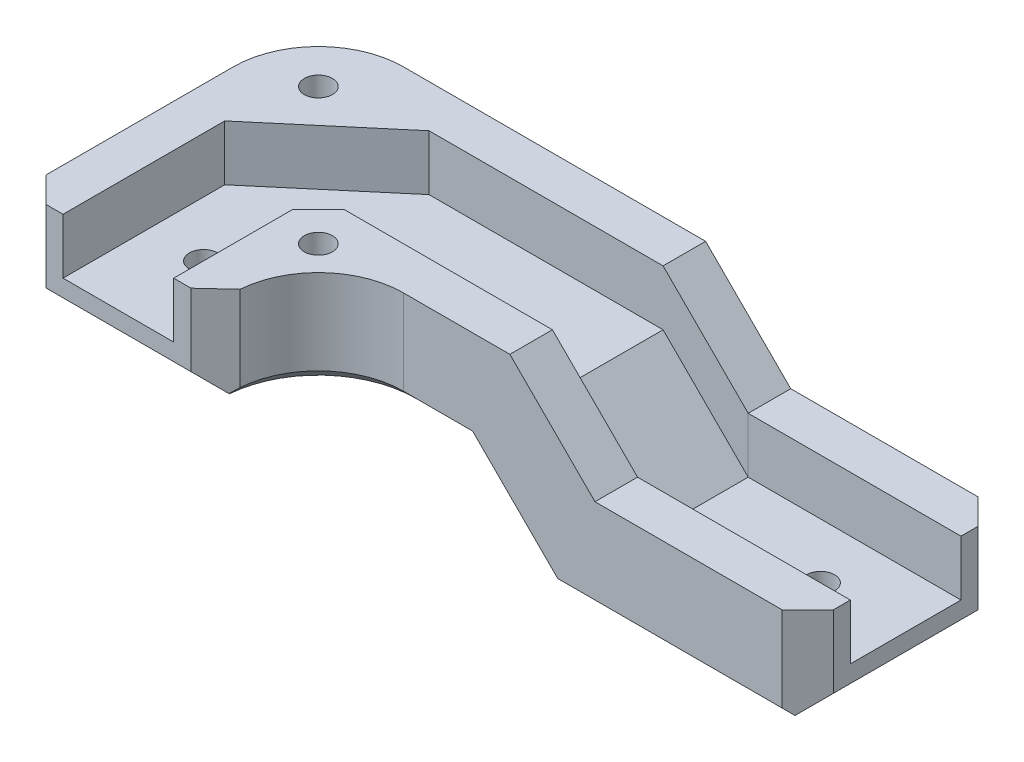
from build123d import *

# Parameters (mm, degrees)
SKETCH_1_W               = 23
SKETCH_1_H               = 23
SKETCH_1_W_2             = 13
SKETCH_1_H_2             = 13
EXTRUDE_1_DEPTH          = 35
SKETCH_2_R               = 1.65
CUT_EXTRUDE_1_DEPTH      = 34
SKETCH_4_W               = 23
SKETCH_4_H               = 23
SKETCH_4_R               = 3
EXTRUDE_2_DEPTH          = 3.5
SKETCH_5_W               = 23
SKETCH_5_H               = 23
SKETCH_5_W_2             = 13
SKETCH_5_H_2             = 13
EXTRUDE_1_2_DEPTH        = 54
SKETCH_6_R               = 1.65
CUT_EXTRUDE_2_DEPTH      = 39
SKETCH_7_W               = 13
SKETCH_7_H               = 13
CUT_EXTRUDE_3_DEPTH      = 13
CHAMFER_1_SIZE           = 3
SKETCH_8_W               = 80.5
SKETCH_8_H               = 35
CUT_EXTRUDE_4_DEPTH      = 11.5
EXTRUDE_3_DEPTH          = 6.5
FILLET_1_R               = 10
FILLET_2_R               = 10
SKETCH_10_R              = 1.65
CUT_EXTRUDE_5_DEPTH      = 28.5
CHAMFER_4_SIZE           = 3
CHAMFER_START            = 6.5
CHAMFER_5_DEPTH          = 11.5
CUT_EXTRUDE_6_DEPTH      = 106
CUT_EXTRUDE_6_DEPTH_BACK = 86
SKETCH_12_W              = 100.531840745
SKETCH_12_H              = 30.474622789
SKETCH_13_W              = 10
SKETCH_13_H              = 23
EXTRUDE_5_DEPTH          = 10
CHAMFER_13_SIZE          = 10
CHAMFER_14_SIZE          = 10
CHAMFER_15_SIZE          = 5
CHAMFER_16_SIZE          = 5
CHAMFER_17_SIZE          = 1.5


with BuildPart() as part:
    # 草图1 → Extrude 1 (new body)
    with BuildSketch(Plane.XY):
        with Locations((6.5, 6.5)):
            Rectangle(SKETCH_1_W, SKETCH_1_H)
        with Locations((6.5, 6.5)):
            Rectangle(SKETCH_1_W_2, SKETCH_1_H_2, mode=Mode.SUBTRACT)
    extrude(amount=EXTRUDE_1_DEPTH)

    # 草图2 → 切除-拉伸1 (cut)
    with BuildSketch(Plane.XZ.offset(5)):
        with Locations(Location((6.5, 25, 0), (0, 0, 270))):
            Circle(SKETCH_2_R)
    extrude(amount=-CUT_EXTRUDE_1_DEPTH, mode=Mode.SUBTRACT)

    # 草图4 → 凸台-拉伸2 (add)
    with BuildSketch(Plane(origin=(18, 0, 0), x_dir=(0, 0, -1), z_dir=(1, 0, 0))):
        with Locations((-11.5, 6.5)):
            Rectangle(SKETCH_4_W, SKETCH_4_H)
        with Locations(Location((-11.5, 6.5, 0), (0, 0, 90))):
            Circle(SKETCH_4_R, mode=Mode.SUBTRACT)
    extrude(amount=EXTRUDE_2_DEPTH)

    # 草图5 → Extrude 1 2 (add)
    with BuildSketch(Plane(origin=(21.5, 0, 0), x_dir=(0, 0, -1), z_dir=(1, 0, 0))):
        with Locations((-11.5, 6.5)):
            Rectangle(SKETCH_5_W, SKETCH_5_H)
        with Locations((-11.5, 6.5)):
            Rectangle(SKETCH_5_W_2, SKETCH_5_H_2, mode=Mode.SUBTRACT)
    extrude(amount=EXTRUDE_1_2_DEPTH)

    # 草图6 → 切除-拉伸2 (cut)
    with BuildSketch(Plane(origin=(0, 18, 0), x_dir=(1, 0, 0), z_dir=(0, 1, 0))):
        with Locations(Location((65.5, -11.5, 0), (0, 0, 270))):
            Circle(SKETCH_6_R)
    extrude(amount=-CUT_EXTRUDE_2_DEPTH, mode=Mode.SUBTRACT)

    # 草图7 → 切除-拉伸3 (cut)
    with BuildSketch(Plane(origin=(21.5, 0, 0), x_dir=(0, 0, -1), z_dir=(1, 0, 0))):
        with Locations((-11.5, 6.5)):
            Rectangle(SKETCH_7_W, SKETCH_7_H)
    extrude(amount=-CUT_EXTRUDE_3_DEPTH, mode=Mode.SUBTRACT)

    # 倒角1
    chamfer_1_edges = [part.edges().sort_by_distance(p)[0] for p in [
        (13, 6.5, 18),
    ]]
    chamfer(chamfer_1_edges, length=CHAMFER_1_SIZE)

    # 草图8 → 切除-拉伸4 (cut)
    with BuildSketch(Plane.XZ.offset(5)):
        with Locations((35.25, 17.5)):
            Rectangle(SKETCH_8_W, SKETCH_8_H)
    extrude(amount=-CUT_EXTRUDE_4_DEPTH, mode=Mode.SUBTRACT)

    # 草图9 → 凸台-拉伸3 (add)
    with BuildSketch(Plane.XZ.offset(-13)):
        Polygon((13, 5), (0, 16), (0, 0), (13, 0), align=None)
    extrude(amount=EXTRUDE_3_DEPTH)

    # 圆角1
    fillet_1_edges = [part.edges().sort_by_distance(p)[0] for p in [
        (-5, 12.25, 0),
    ]]
    fillet(fillet_1_edges, radius=FILLET_1_R)

    # 圆角2
    fillet_2_edges = [part.edges().sort_by_distance(p)[0] for p in [
        (18, 12.25, 23),
    ]]
    fillet(fillet_2_edges, radius=FILLET_2_R)

    # 草图10 → 切除-拉伸5 (cut)
    with BuildSketch(Plane.XZ.offset(-6.5)):
        with Locations(Location((2, 7, 0), (0, 0, 270))):
            Circle(SKETCH_10_R)
        with Locations(Location((18, 23, 0), (0, 0, 270))):
            Circle(SKETCH_10_R)
    extrude(amount=-CUT_EXTRUDE_5_DEPTH, mode=Mode.SUBTRACT)

    # 倒角4
    chamfer_4_edges = [part.edges().sort_by_distance(p)[0] for p in [
        (75.5, 18, 11.5),
        (6.5, 18, 35),
    ]]
    chamfer(chamfer_4_edges, length=CHAMFER_4_SIZE)

    # 倒角5: read off the stored shape, not the designer's step
    # 倒角5 outline → 倒角5 (cut)
    with BuildSketch(Plane(origin=(0, 0, 0), x_dir=(1, 0, 0), z_dir=(0, 1, 0)).offset(CHAMFER_START)):
        Polygon((72.5, 0), (75.5, -3), (75.5, 0), align=None)
        Polygon((-5, -35), (-2, -35), (-5, -32), align=None)
        with BuildLine():
            ThreePointArc((18, -33), (18.007410169, -32.615099398), (18.029629695, -32.230769231))
            Line((18.029629695, -32.230769231), (15.038518603, -35))
            Line((15.038518603, -35), (18, -35))
            Line((18, -35), (18, -33))
        make_face()
        Polygon((75.5, -20), (72.5, -23), (75.5, -23), align=None)
    extrude(amount=CHAMFER_5_DEPTH, mode=Mode.SUBTRACT)


with BuildPart() as body_2:
    # Split Bodies 1: the piece on the far side of the plane
    add(part.part)
    split(bisect_by=Plane.YZ.offset(50.5), keep=Keep.BOTTOM)


with BuildPart() as part_1:
    add(part.part)

    # Split Bodies 1
    split(bisect_by=Plane.YZ.offset(50.5), keep=Keep.TOP)


with BuildPart() as part_2:
    # Move Body 1: read off the stored shape, not the designer's step
    # Move Body 1: moved
    add(part_1.part.moved(Location((0, 10, 0))))

    # Combine 1: union body 2
    add(body_2.part)


with BuildPart() as body_2_2:
    # 镜向1: mirrored copy
    add(part_2.part.mirror(Plane(origin=(-5, 28, 35), x_dir=(0, 0, 1), z_dir=(0, -1, 0))))

    # 草图13 → 凸台-拉伸5 (add)
    with BuildSketch(Plane.XZ.offset(-38)):
        with Locations((45.5, 11.5)):
            Rectangle(SKETCH_13_W, SKETCH_13_H)
    extrude(amount=EXTRUDE_5_DEPTH)

    # 倒角13
    # the kernel refuses this chamfer: 10 mm, written as the material it takes off along each edge
    with BuildSketch(Plane(origin=(50.5, 43, 5), x_dir=(0, -1, 0), z_dir=(0, 0, 1))) as chamfer_13_piece_1:
        Polygon((CHAMFER_13_SIZE, 0), (0, -CHAMFER_13_SIZE), (0, 0), align=None)
    extrude(amount=13, mode=Mode.SUBTRACT)

    # 倒角14
    chamfer_14_edges = [body_2_2.edges().sort_by_distance(p)[0] for p in [
        (50.5, 49.5, 2.5),
        (50.5, 49.5, 20.5),
    ]]
    chamfer(chamfer_14_edges, length=CHAMFER_14_SIZE - 0.0001)  # a hair under: the kernel refuses the full size

    # 倒角15
    chamfer_15_edges = [body_2_2.edges().sort_by_distance(p)[0] for p in [
        (40.5, 38, 11.5),
    ]]
    chamfer(chamfer_15_edges, length=CHAMFER_15_SIZE)

    # 倒角16
    chamfer_16_edges = [body_2_2.edges().sort_by_distance(p)[0] for p in [
        (40.5, 28, 11.5),
    ]]
    chamfer(chamfer_16_edges, length=CHAMFER_16_SIZE - 0.0001)  # a hair under: the kernel refuses the full size

    # 倒角17
    chamfer_17_edges = [body_2_2.edges().sort_by_distance(p)[0] for p in [
        (40.5, 32.99995, 23),
        (42.99995, 30.49995, 23),
        (38, 35.5, 23),
        (58.99995, 28, 23),
        (31.75, 38, 23),
        (40.5, 32.99995, 0),
        (42.99995, 30.49995, 0),
        (38, 35.5, 0),
        (58.99995, 28, 0),
        (20.25, 38, 0),
        (-2.071067812, 38, 2.928932188),
        (-5, 38, 21),
        (21.291796068, 38, 25.583801513),
    ]]
    chamfer(chamfer_17_edges, length=CHAMFER_17_SIZE)


with BuildPart() as part_3:
    add(part_2.part)

    # 草图12 → 切除-拉伸6 (cut, two sides: drawn at the far end of the back side and taken through both)
    with BuildSketch(Plane.XY.offset(23).offset(-CUT_EXTRUDE_6_DEPTH_BACK)):
        with Locations((32.005641973, 12.762688605)):
            Rectangle(SKETCH_12_W, SKETCH_12_H)
    extrude(amount=CUT_EXTRUDE_6_DEPTH + CUT_EXTRUDE_6_DEPTH_BACK, mode=Mode.SUBTRACT)


solid = body_2_2.part
